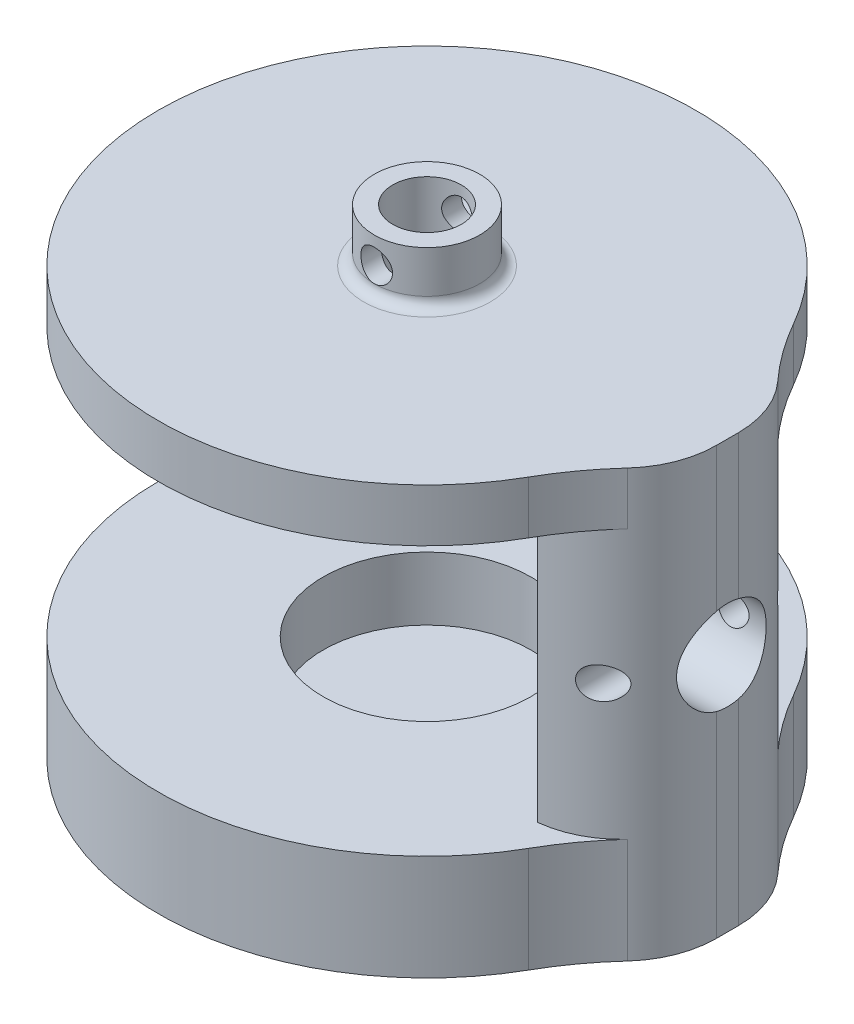
from build123d import *

# Parameters (mm, degrees)
SKETCH1_W               = 22.25
SKETCH1_H               = 5
BOSS_EXTRUDE1_DEPTH     = 10
FILLET2_R               = 9
FILLET4_R               = 30
SKETCH4_R               = 4.25
CUT_EXTRUDE1_DEPTH      = 74
CUT_EXTRUDE3_DEPTH      = 45.497893381
CUT_EXTRUDE3_DEPTH_BACK = 45.497893381
SKETCH6_R               = 1.5
SKETCH7_R               = 5
SKETCH7_R_2             = 3.25
BOSS_EXTRUDE2_DEPTH     = 5
FILLET6_R               = 1
CUT_EXTRUDE4_DEPTH      = 45.497893381
CUT_EXTRUDE4_DEPTH_BACK = 45.497893381
SKETCH8_R               = 1.5


with BuildPart() as part:
    # Sketch1 → Revolve1 (revolve)
    with BuildSketch(Plane.XY):
        Polygon((25.5, -22.75), (25.5, -12.75), (9.85, -12.75), (9.85, -18.75), (0, -18.75), (0, -22.75), align=None)
        with Locations((14.375, 15.25)):
            Rectangle(SKETCH1_W, SKETCH1_H)
    revolve(axis=Axis((0, -12.75, 0), (0, 1, 0)))


with BuildPart() as body_2:
    # Sketch2 → Boss-Extrude1 (new, symmetric)
    with BuildSketch(Plane.XY):
        Polygon((25.5, -22.75), (28.5, -22.75), (28.5, 17.75), (25.5, 17.75), (20.5, 17.75), (20.5, -22.75), align=None)
    extrude(amount=BOSS_EXTRUDE1_DEPTH, both=True)


with BuildPart() as part_1:
    add(part.part)

    # Intersect2: read off the stored shape, not the designer's step
    # Intersect2: union body 2
    add(body_2.part)

    # Fillet2
    # the kernel refuses this fillet: 9 mm, written as the material it takes off along each edge
    with BuildSketch(Plane(origin=(28.5, -45.110679775, -10), x_dir=(-1, 0, 0), z_dir=(0, 1, 0))) as fillet2_piece_1_section:
        with BuildLine():
            CenterArc((9, 8.94427191), FILLET2_R, 180, 83.620629792)
            Line((0, 8.94427191), (0, 0))
            Line((0, 0), (8, 0))
        make_face()
    fillet2_piece_1 = extrude(amount=85.22135955, mode=Mode.PRIVATE)
    fillet2_piece_1 = fillet2_piece_1 - Plane(origin=(0, -45.110679775, 0), x_dir=(1, 0, 0), z_dir=(0, 1, 0)) * Cylinder(25.5, 207, mode=Mode.PRIVATE)
    add(fillet2_piece_1, mode=Mode.SUBTRACT)
    with BuildSketch(Plane(origin=(28.5, -45.110679775, -10), x_dir=(-1, 0, 0), z_dir=(0, 1, 0))) as fillet2_piece_2_section:
        with BuildLine():
            CenterArc((9, 8.94427191), FILLET2_R, 180, 83.620629792)
            Line((0, 8.94427191), (0, 0))
            Line((0, 0), (8, 0))
        make_face()
    fillet2_piece_2 = extrude(amount=85.22135955, mode=Mode.PRIVATE)
    fillet2_piece_2 = split(fillet2_piece_2, bisect_by=Plane(origin=(28.5, -12.75, -10), z_dir=(0, 1, 0)), keep=Keep.TOP, mode=Mode.PRIVATE)
    fillet2_piece_2 = split(fillet2_piece_2, bisect_by=Plane(origin=(28.5, 12.75, -10), z_dir=(0, -1, 0)), keep=Keep.TOP, mode=Mode.PRIVATE)
    add(fillet2_piece_2, mode=Mode.SUBTRACT)
    with BuildSketch(Plane(origin=(28.5, -45.110679775, 10), x_dir=(-1, 0, 0), z_dir=(0, 1, 0))) as fillet2_piece_3_section:
        with BuildLine():
            CenterArc((9, -8.94427191), FILLET2_R, 96.379370208, 83.620629792)
            Line((0, -8.94427191), (0, 0))
            Line((0, 0), (8, 0))
        make_face()
    fillet2_piece_3 = extrude(amount=85.22135955, mode=Mode.PRIVATE)
    fillet2_piece_3 = fillet2_piece_3 - Plane(origin=(0, -45.110679775, 0), x_dir=(1, 0, 0), z_dir=(0, 1, 0)) * Cylinder(25.5, 207, mode=Mode.PRIVATE)
    add(fillet2_piece_3, mode=Mode.SUBTRACT)
    with BuildSketch(Plane(origin=(28.5, -45.110679775, 10), x_dir=(-1, 0, 0), z_dir=(0, 1, 0))) as fillet2_piece_4_section:
        with BuildLine():
            CenterArc((9, -8.94427191), FILLET2_R, 96.379370208, 83.620629792)
            Line((0, -8.94427191), (0, 0))
            Line((0, 0), (8, 0))
        make_face()
    fillet2_piece_4 = extrude(amount=85.22135955, mode=Mode.PRIVATE)
    fillet2_piece_4 = split(fillet2_piece_4, bisect_by=Plane(origin=(28.5, -12.75, 10), z_dir=(0, 1, 0)), keep=Keep.TOP, mode=Mode.PRIVATE)
    fillet2_piece_4 = split(fillet2_piece_4, bisect_by=Plane(origin=(28.5, 12.75, 10), z_dir=(0, -1, 0)), keep=Keep.TOP, mode=Mode.PRIVATE)
    add(fillet2_piece_4, mode=Mode.SUBTRACT)

    # Fillet4
    fillet4_edges = [part_1.edges().sort_by_distance(p)[0] for p in [
        (23.892282884, 15.25, -8.911162582),
        (23.892282884, -17.75, -8.911162582),
        (23.892282884, 15.25, 8.911162582),
        (23.892282884, -17.75, 8.911162582),
    ]]
    fillet(fillet4_edges, radius=FILLET4_R)

    # Sketch4 → Cut-Extrude1 (cut)
    with BuildSketch(Plane(origin=(0, 0, 0), x_dir=(0, 0, -1), z_dir=(1, 0, 0))):
        with Locations(Location((0, 0, 0), (0, 0, 255.616756445))):
            Circle(SKETCH4_R)
    extrude(amount=CUT_EXTRUDE1_DEPTH, mode=Mode.SUBTRACT)

    # Sketch6 → Cut-Extrude3 (cut, two sides: drawn at the far end of the back side and taken through both)
    with BuildSketch(Plane.XY.offset(-CUT_EXTRUDE3_DEPTH_BACK)):
        with Locations((24.798321038, 0)):
            Circle(SKETCH6_R)
    extrude(amount=CUT_EXTRUDE3_DEPTH + CUT_EXTRUDE3_DEPTH_BACK, mode=Mode.SUBTRACT)

    # Sketch7 → Boss-Extrude2 (add)
    with BuildSketch(Plane(origin=(0, 17.75, 0), x_dir=(1, 0, 0), z_dir=(0, 1, 0))):
        Circle(SKETCH7_R)
        Circle(SKETCH7_R_2, mode=Mode.SUBTRACT)
    extrude(amount=BOSS_EXTRUDE2_DEPTH)

    # Fillet6
    fillet6_edges = [part_1.edges().sort_by_distance(p)[0] for p in [
        (-5, 17.75, 0),
    ]]
    fillet(fillet6_edges, radius=FILLET6_R)

    # Sketch8 → Cut-Extrude4 (cut, two sides: drawn at the far end of the back side and taken through both)
    with BuildSketch(Plane.XY.offset(-CUT_EXTRUDE4_DEPTH_BACK)):
        with Locations((0, 20.25)):
            Circle(SKETCH8_R)
    extrude(amount=CUT_EXTRUDE4_DEPTH + CUT_EXTRUDE4_DEPTH_BACK, mode=Mode.SUBTRACT)


solid = part_1.part
